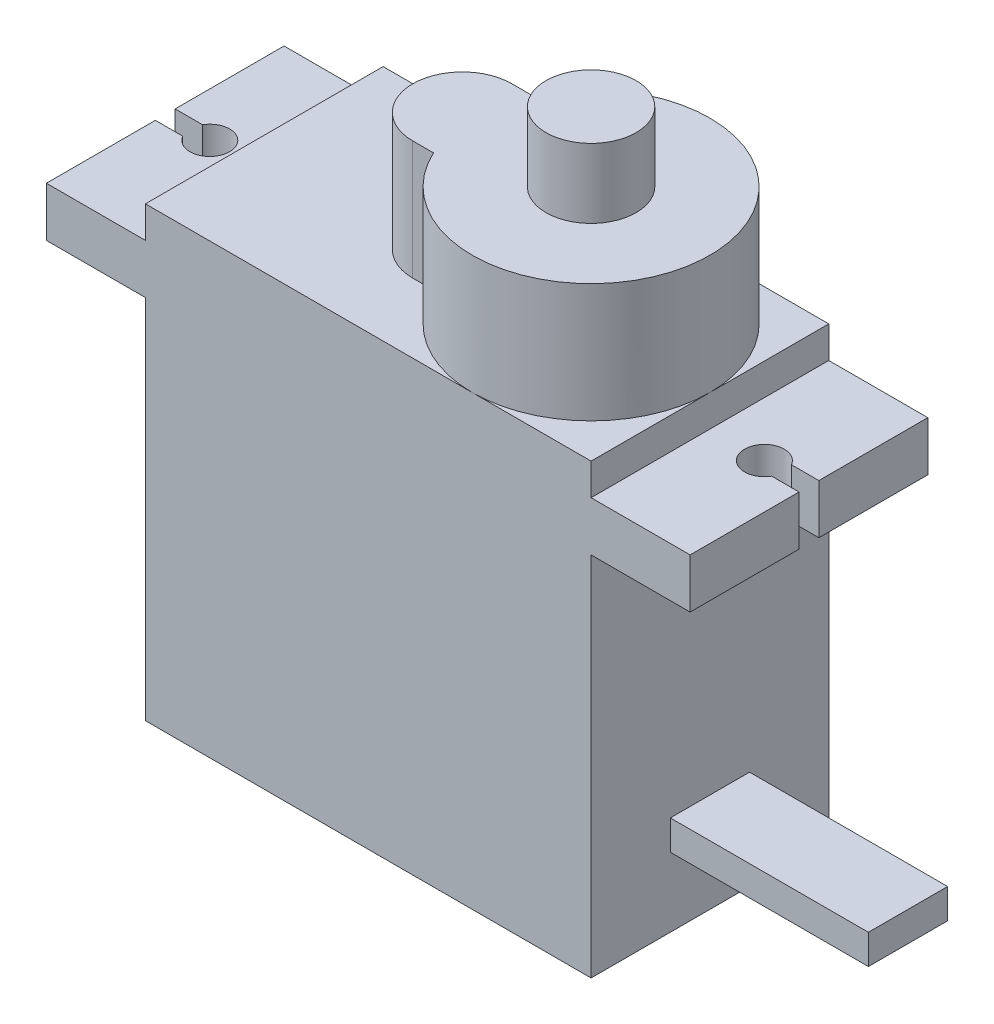
from build123d import *

# Parameters (mm, degrees)
BOSS_EXTRUDE1_DEPTH = 12
SKETCH2_W           = 4
SKETCH2_H           = 1.5
BOSS_EXTRUDE2_DEPTH = 10
CUT_EXTRUDE1_DEPTH  = 2.5
BOSS_EXTRUDE4_DEPTH = 6
SKETCH6_R           = 2.275
BOSS_EXTRUDE5_DEPTH = 3.5


# Read off the part's stored shape, not the designer's step: Boss-Extrude4
with BuildPart() as part:
    # Sketch1 → Boss-Extrude1 (new body)
    with BuildSketch(Plane.XY):
        Polygon((-11.25, 11.3), (11.25, 11.3), (11.25, 9.7), (16.25, 9.7), (16.25, 7.2), (11.25, 7.2), (11.25, -11.3), (-11.25, -11.3), (-11.25, 7.2), (-16.25, 7.2), (-16.25, 9.7), (-11.25, 9.7), align=None)
    extrude(amount=-BOSS_EXTRUDE1_DEPTH)

    # Sketch2 → Boss-Extrude2 (add)
    with BuildSketch(Plane(origin=(11.25, 0, 0), x_dir=(0, 0, -1), z_dir=(1, 0, 0))):
        with Locations((6, -7.05)):
            Rectangle(SKETCH2_W, SKETCH2_H)
    extrude(amount=BOSS_EXTRUDE2_DEPTH)

    # Sketch3 → Cut-Extrude1 (cut)
    with BuildSketch(Plane(origin=(0, 9.7, 0), x_dir=(1, 0, 0), z_dir=(0, 1, 0))):
        with BuildLine():
            Line((-16.25, 6.5), (-14.866025404, 6.5))
            ThreePointArc((-14.866025404, 6.5), (-13, 6), (-14.866025404, 5.5))
            Line((-14.866025404, 5.5), (-16.25, 5.5))
            Line((-16.25, 5.5), (-16.25, 6.5))
        make_face()
        with BuildLine():
            Line((16.25, 6.5), (14.866025404, 6.5))
            ThreePointArc((14.866025404, 6.5), (13, 6), (14.866025404, 5.5))
            Line((14.866025404, 5.5), (16.25, 5.5))
            Line((16.25, 5.5), (16.25, 6.5))
        make_face()
    extrude(amount=-CUT_EXTRUDE1_DEPTH, mode=Mode.SUBTRACT)

    # Boss-Extrude4 outline → Boss-Extrude4 (add)
    with BuildSketch(Plane(origin=(0, 11.3, 0), x_dir=(1, 0, 0), z_dir=(0, 1, 0))):
        with BuildLine():
            Line((-0.204356057, 8.5), (-1.254356051, 8.499996205))
            ThreePointArc((-1.254356051, 8.499996205), (-3.75, 6), (-1.254356051, 3.500003795))
            Line((-1.254356051, 3.500003795), (-0.204356057, 3.5))
            ThreePointArc((-0.204356057, 3.5), (11.25, 6), (-0.204356057, 8.5))
        make_face()
    extrude(amount=BOSS_EXTRUDE4_DEPTH)

    # Sketch6 → Boss-Extrude5 (add)
    with BuildSketch(Plane(origin=(0, 17.3, 0), x_dir=(1, 0, 0), z_dir=(0, 1, 0))):
        with Locations(Location((5.25, 6, 0), (0, 0, 270))):
            Circle(SKETCH6_R)
    extrude(amount=BOSS_EXTRUDE5_DEPTH)


solid = part.part
